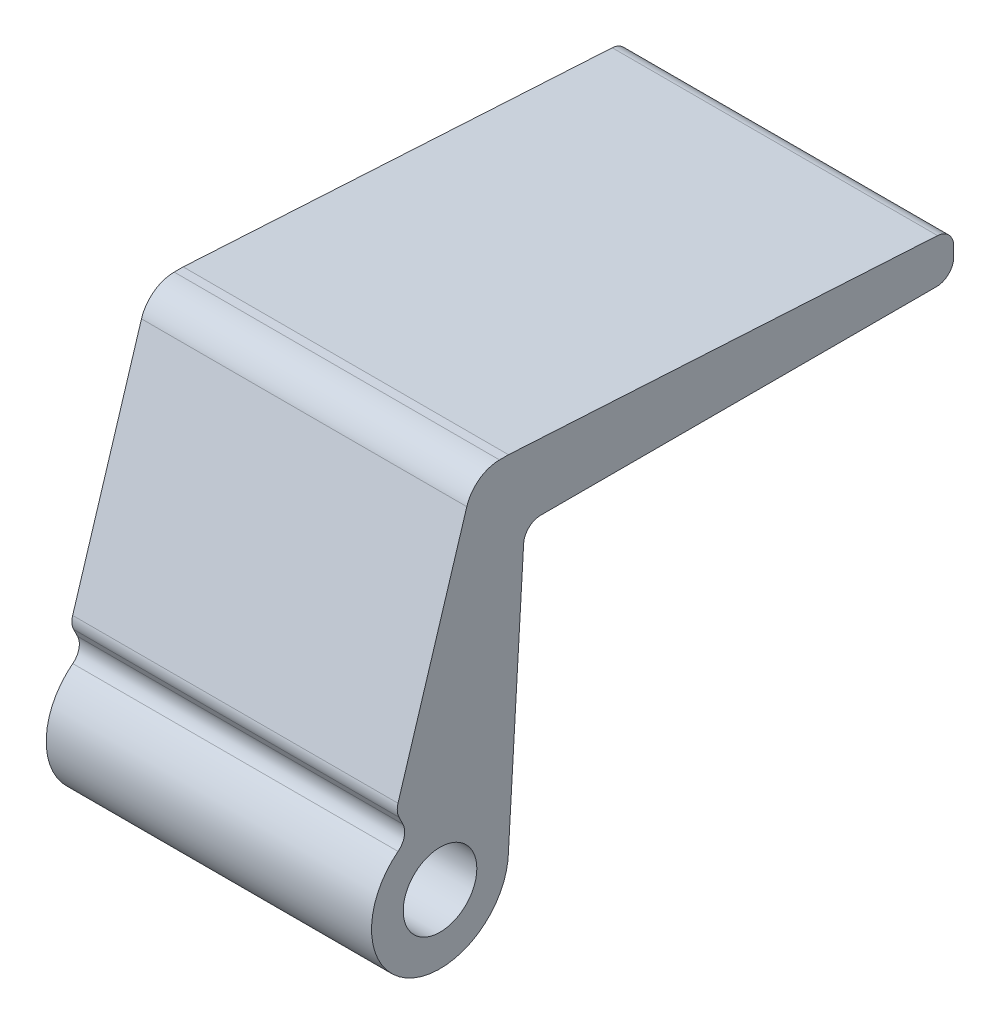
from build123d import *

# Parameters (mm, degrees)
SKETCH1_R           = 2.15
BOSS_EXTRUDE1_DEPTH = 9.5
FILLET1_R           = 2
FILLET2_R           = 1


with BuildPart() as part:
    # Sketch1 → Boss-Extrude1 (new, symmetric)
    with BuildSketch(Plane(origin=(0, 0, 0), x_dir=(0, 0, -1), z_dir=(1, 0, 0))):
        with BuildLine():
            Line((30.000000003, 18.500000001), (30.000000003, 17.000000001))
            Line((30.000000003, 17.000000001), (30.000000003, 16.000000001))
            Line((30.000000003, 16.000000001), (4.938794327, 16.000000001))
            Line((4.938794327, 16.000000001), (3.999999997, 0))
            ThreePointArc((3.999999997, 0), (-2.112780754, -3.396491934), (-1.768078738, 3.588021398))
            Line((-1.768078738, 3.588021398), (-2.572234834, 5.219922296))
            Line((-2.572234834, 5.219922296), (2, 20.000000001))
            Line((2, 20.000000001), (3.999999997, 20.000000001))
            Line((3.999999997, 20.000000001), (30.000000003, 18.500000001))
        make_face()
        Circle(SKETCH1_R, mode=Mode.SUBTRACT)
    extrude(amount=BOSS_EXTRUDE1_DEPTH, both=True)

    # Fillet1
    fillet1_edges = [part.edges().sort_by_distance(p)[0] for p in [
        (0, 20.000000001, -2),
    ]]
    fillet(fillet1_edges, radius=FILLET1_R)

    # Fillet2
    fillet2_edges = [part.edges().sort_by_distance(p)[0] for p in [
        (0, 18.500000001, -30.000000003),
        (0, 16.000000001, -30.000000003),
        (0, 16.000000001, -4.938794327),
        (0, 3.588021398, 1.768078738),
        (0, 5.219922296, 2.572234834),
    ]]
    fillet(fillet2_edges, radius=FILLET2_R)


solid = part.part
